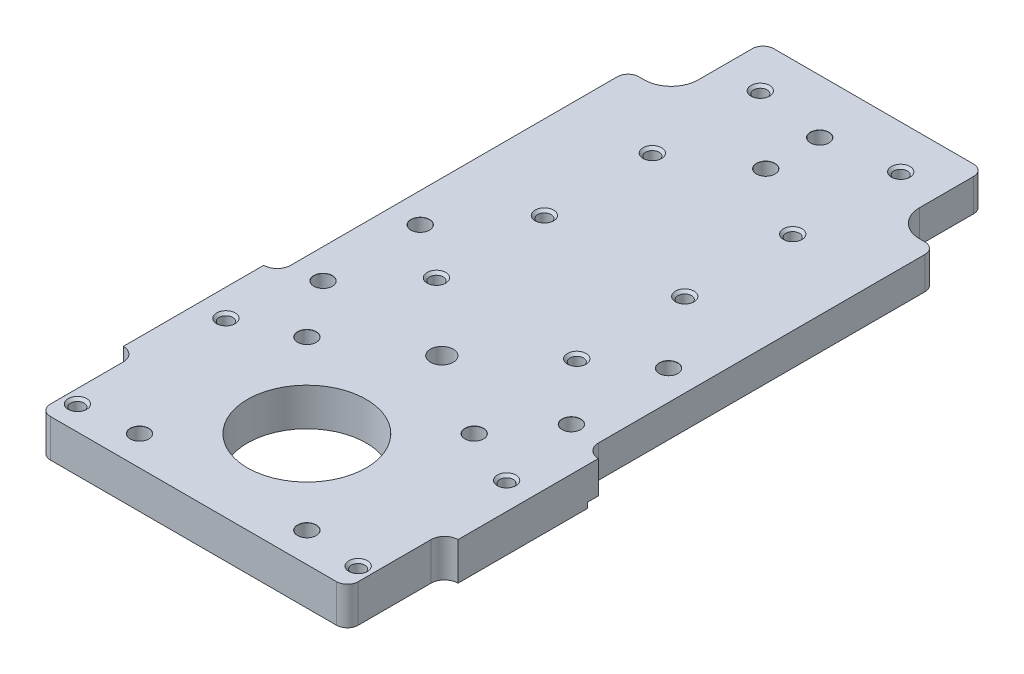
from build123d import *

# Parameters (mm, degrees)
PLATE_MAIN_SKETCH_R             = 11
PLATE_MAIN_SKETCH_R_2           = 2.111650326
EXTRUDE_PLATE_MAIN_DEPTH        = 7
FILLET1_R                       = 2
M3X0_5_TAPPED_HOLE3_AT_2_COUNT  = 2
M3X0_5_TAPPED_HOLE3_AT_2_PITCH  = 27.5
M3X0_5_TAPPED_HOLE3_AT_3_COUNT  = 2
M3X0_5_TAPPED_HOLE3_AT_3_PITCH  = 58.823889705
M3X0_5_TAPPED_HOLE3_AT_4_COUNT  = 2
M3X0_5_TAPPED_HOLE3_AT_4_PITCH  = 66.206117542
M3X0_5_TAPPED_HOLE3_AT_5_COUNT  = 2
M3X0_5_TAPPED_HOLE3_AT_5_PITCH  = 83.20606949
M3X0_5_TAPPED_HOLE3_AT_6_COUNT  = 2
M3X0_5_TAPPED_HOLE3_AT_6_PITCH  = 101.307699609
M3X0_5_TAPPED_HOLE3_AT_7_COUNT  = 2
M3X0_5_TAPPED_HOLE3_AT_7_PITCH  = 120.013540903
M3X0_5_TAPPED_HOLE3_AT_8_COUNT  = 2
M3X0_5_TAPPED_HOLE3_AT_8_PITCH  = 114.242067558
M3X0_5_TAPPED_HOLE3_AT_9_COUNT  = 2
M3X0_5_TAPPED_HOLE3_AT_9_PITCH  = 94.399417371
M3X0_5_TAPPED_HOLE3_AT_10_COUNT = 2
M3X0_5_TAPPED_HOLE3_AT_10_PITCH = 74.640806534
M3X0_5_TAPPED_HOLE3_AT_11_COUNT = 2
M3X0_5_TAPPED_HOLE3_AT_11_PITCH = 55.056788864
M3X0_5_TAPPED_HOLE3_AT_12_COUNT = 2
M3X0_5_TAPPED_HOLE3_AT_12_PITCH = 52
CBORE_FOR_M3_SHCS1_AT_2_COUNT   = 2
CBORE_FOR_M3_SHCS1_AT_2_PITCH   = 31
CBORE_FOR_M3_SHCS1_AT_3_COUNT   = 2
CBORE_FOR_M3_SHCS1_AT_3_PITCH   = 43.840620434
CBORE_FOR_M3_SHCS1_AT_4_COUNT   = 2
CBORE_FOR_M3_SHCS1_AT_4_PITCH   = 31
CBORE_FOR_M3_SHCS1_AT_5_COUNT   = 2
CBORE_FOR_M3_SHCS1_AT_5_PITCH   = 42.172265768
CBORE_FOR_M3_SHCS1_AT_6_COUNT   = 2
CBORE_FOR_M3_SHCS1_AT_6_PITCH   = 56.608303278
CBORE_FOR_M3_SHCS1_AT_7_COUNT   = 2
CBORE_FOR_M3_SHCS1_AT_7_PITCH   = 70.86959856
CBORE_FOR_M3_SHCS1_AT_8_COUNT   = 2
CBORE_FOR_M3_SHCS1_AT_8_PITCH   = 59.970826241
CBORE_FOR_M3_SHCS1_AT_9_COUNT   = 2
CBORE_FOR_M3_SHCS1_AT_9_PITCH   = 101.688249075
CBORE_FOR_M3_SHCS1_AT_10_COUNT  = 2
CBORE_FOR_M3_SHCS1_AT_10_PITCH  = 111.581808553
CUT_RECESS_DEPTH                = 1


with BuildPart() as part:
    # Plate Main Sketch → Extrude Plate Main (new body)
    with BuildSketch(Plane(origin=(-158.085545862, 0, 24.679095537), x_dir=(-1, 0, 0), z_dir=(0, 1, 0))):
        with BuildLine():
            Line((-178.585545862, -24.679095537), (-137.585545862, -24.679095537))
            Line((-137.585545862, -24.679095537), (-137.585545862, -12.679095537))
            ThreePointArc((-137.585545862, -12.679095537), (-136.121079768, -9.143561631), (-132.585545862, -7.679095537))
            Line((-132.585545862, -7.679095537), (-129.585545862, -7.679095537))
            Line((-129.585545862, -7.679095537), (-129.585545862, 54.820904463))
            ThreePointArc((-129.585545862, 54.820904463), (-128.853312815, 56.588671416), (-127.085545862, 57.320904463))
            Line((-127.085545862, 57.320904463), (-127.085545862, 83.320904463))
            ThreePointArc((-127.085545862, 83.320904463), (-128.853312815, 84.05313751), (-129.585545862, 85.820904463))
            Line((-129.585545862, 85.820904463), (-129.585545862, 101.320904463))
            Line((-129.585545862, 101.320904463), (-186.585545862, 101.320904463))
            Line((-186.585545862, 101.320904463), (-186.585545862, 85.820904463))
            ThreePointArc((-186.585545862, 85.820904463), (-187.317778909, 84.05313751), (-189.085545862, 83.320904463))
            Line((-189.085545862, 83.320904463), (-189.085545862, 57.320904463))
            ThreePointArc((-189.085545862, 57.320904463), (-187.317778909, 56.588671416), (-186.585545862, 54.820904463))
            Line((-186.585545862, 54.820904463), (-186.585545862, -7.679095537))
            Line((-186.585545862, -7.679095537), (-183.585545862, -7.679095537))
            ThreePointArc((-183.585545862, -7.679095537), (-180.050011956, -9.143561631), (-178.585545862, -12.679095537))
            Line((-178.585545862, -12.679095537), (-178.585545862, -24.679095537))
        make_face()
        with Locations((-158.085545862, 80.320904463)):
            Circle(PLATE_MAIN_SKETCH_R, mode=Mode.SUBTRACT)
        with Locations((-158.085545862, 55.320904463)):
            Circle(PLATE_MAIN_SKETCH_R_2, mode=Mode.SUBTRACT)
    extrude(amount=EXTRUDE_PLATE_MAIN_DEPTH)

    # Fillet1
    fillet1_edges = [part.edges().sort_by_distance(p)[0] for p in [
        (-28.5, 3.5, 126),
        (-28.5, 3.5, 17),
        (-20.5, 3.5, 0),
        (20.5, 3.5, 0),
        (28.5, 3.5, 17),
        (28.5, 3.5, 126),
    ]]
    fillet(fillet1_edges, radius=FILLET1_R)

    # Sketch13 → M3x0.5 Tapped Hole3 (revolve, cut)
    with BuildSketch(Plane(origin=(26, 0, 121.5), x_dir=(0, 0, -1), z_dir=(1, 0, 0))):
        Polygon((0, 0), (0, 7), (1.725, 7), (1.25, 6.525), (1.25, 0), align=None)
    m3x0_5_tapped_hole3 = revolve(axis=Axis((26, -6.35, 121.5), (0, 1, 0)), mode=Mode.SUBTRACT)

    # M3x0.5 Tapped Hole3 at 2: M3x0.5 Tapped Hole3 ×2
    with Locations(*[(0, 0, -i * M3X0_5_TAPPED_HOLE3_AT_2_PITCH) for i in range(1, M3X0_5_TAPPED_HOLE3_AT_2_COUNT)]):
        add(m3x0_5_tapped_hole3, mode=Mode.SUBTRACT)

    # M3x0.5 Tapped Hole3 at 3: M3x0.5 Tapped Hole3 ×2
    with Locations(*[Vector(-0.8839945855497452, 0, -0.46749713658880765) * (i * M3X0_5_TAPPED_HOLE3_AT_3_PITCH) for i in range(1, M3X0_5_TAPPED_HOLE3_AT_3_COUNT)]):
        add(m3x0_5_tapped_hole3, mode=Mode.SUBTRACT)

    # M3x0.5 Tapped Hole3 at 4: M3x0.5 Tapped Hole3 ×2
    with Locations(*[Vector(-0.5890694311623529, 0, -0.8080824247996377) * (i * M3X0_5_TAPPED_HOLE3_AT_4_PITCH) for i in range(1, M3X0_5_TAPPED_HOLE3_AT_4_COUNT)]):
        add(m3x0_5_tapped_hole3, mode=Mode.SUBTRACT)

    # M3x0.5 Tapped Hole3 at 5: M3x0.5 Tapped Hole3 ×2
    with Locations(*[Vector(-0.46871580689935055, 0, -0.8833490206949294) * (i * M3X0_5_TAPPED_HOLE3_AT_5_PITCH) for i in range(1, M3X0_5_TAPPED_HOLE3_AT_5_COUNT)]):
        add(m3x0_5_tapped_hole3, mode=Mode.SUBTRACT)

    # M3x0.5 Tapped Hole3 at 6: M3x0.5 Tapped Hole3 ×2
    with Locations(*[Vector(-0.38496580369162126, 0, -0.9229308370555532) * (i * M3X0_5_TAPPED_HOLE3_AT_6_PITCH) for i in range(1, M3X0_5_TAPPED_HOLE3_AT_6_COUNT)]):
        add(m3x0_5_tapped_hole3, mode=Mode.SUBTRACT)

    # M3x0.5 Tapped Hole3 at 7: M3x0.5 Tapped Hole3 ×2
    with Locations(*[Vector(-0.32496333085967716, 0, -0.9457266167326497) * (i * M3X0_5_TAPPED_HOLE3_AT_7_PITCH) for i in range(1, M3X0_5_TAPPED_HOLE3_AT_7_COUNT)]):
        add(m3x0_5_tapped_hole3, mode=Mode.SUBTRACT)

    # M3x0.5 Tapped Hole3 at 8: M3x0.5 Tapped Hole3 ×2
    with Locations(*[Vector(-0.113793458730633, 0, -0.993504428148219) * (i * M3X0_5_TAPPED_HOLE3_AT_8_PITCH) for i in range(1, M3X0_5_TAPPED_HOLE3_AT_8_COUNT)]):
        add(m3x0_5_tapped_hole3, mode=Mode.SUBTRACT)

    # M3x0.5 Tapped Hole3 at 9: M3x0.5 Tapped Hole3 ×2
    with Locations(*[Vector(-0.13771271435815216, 0, -0.9904722148067102) * (i * M3X0_5_TAPPED_HOLE3_AT_9_PITCH) for i in range(1, M3X0_5_TAPPED_HOLE3_AT_9_COUNT)]):
        add(m3x0_5_tapped_hole3, mode=Mode.SUBTRACT)

    # M3x0.5 Tapped Hole3 at 10: M3x0.5 Tapped Hole3 ×2
    with Locations(*[Vector(-0.17416746420246676, 0, -0.9847160476062541) * (i * M3X0_5_TAPPED_HOLE3_AT_10_PITCH) for i in range(1, M3X0_5_TAPPED_HOLE3_AT_10_COUNT)]):
        add(m3x0_5_tapped_hole3, mode=Mode.SUBTRACT)

    # M3x0.5 Tapped Hole3 at 11: M3x0.5 Tapped Hole3 ×2
    with Locations(*[Vector(-0.23611983677697992, 0, -0.9717239436591096) * (i * M3X0_5_TAPPED_HOLE3_AT_11_PITCH) for i in range(1, M3X0_5_TAPPED_HOLE3_AT_11_COUNT)]):
        add(m3x0_5_tapped_hole3, mode=Mode.SUBTRACT)

    # M3x0.5 Tapped Hole3 at 12: M3x0.5 Tapped Hole3 ×2
    with Locations(*[(-i * M3X0_5_TAPPED_HOLE3_AT_12_PITCH, 0, 0) for i in range(1, M3X0_5_TAPPED_HOLE3_AT_12_COUNT)]):
        add(m3x0_5_tapped_hole3, mode=Mode.SUBTRACT)

    # Sketch5 → CBORE for M3 SHCS1 (revolve, cut)
    with BuildSketch(Plane(origin=(-15.5, 0, 120.5), x_dir=(0, 0, -1), z_dir=(1, 0, 0))):
        Polygon((0, 0), (0, 7), (1.725, 7), (1.7, 6.975), (1.7, 4.5), (3, 4.5), (3, 0), align=None)
    cbore_for_m3_shcs1 = revolve(axis=Axis((-15.5, -6.35, 120.5), (0, 1, 0)), mode=Mode.SUBTRACT)

    # CBORE for M3 SHCS1 at 2: CBORE for M3 SHCS1 ×2
    with Locations(*[(i * CBORE_FOR_M3_SHCS1_AT_2_PITCH, 0, 0) for i in range(1, CBORE_FOR_M3_SHCS1_AT_2_COUNT)]):
        add(cbore_for_m3_shcs1, mode=Mode.SUBTRACT)

    # CBORE for M3 SHCS1 at 3: CBORE for M3 SHCS1 ×2
    with Locations(*[Vector(0.7071067811865479, 0, -0.7071067811865472) * (i * CBORE_FOR_M3_SHCS1_AT_3_PITCH) for i in range(1, CBORE_FOR_M3_SHCS1_AT_3_COUNT)]):
        add(cbore_for_m3_shcs1, mode=Mode.SUBTRACT)

    # CBORE for M3 SHCS1 at 4: CBORE for M3 SHCS1 ×2
    with Locations(*[(0, 0, -i * CBORE_FOR_M3_SHCS1_AT_4_PITCH) for i in range(1, CBORE_FOR_M3_SHCS1_AT_4_COUNT)]):
        add(cbore_for_m3_shcs1, mode=Mode.SUBTRACT)

    # CBORE for M3 SHCS1 at 5: CBORE for M3 SHCS1 ×2
    with Locations(*[Vector(-0.1778419978967634, 0, -0.9840590550287557) * (i * CBORE_FOR_M3_SHCS1_AT_5_PITCH) for i in range(1, CBORE_FOR_M3_SHCS1_AT_5_COUNT)]):
        add(cbore_for_m3_shcs1, mode=Mode.SUBTRACT)

    # CBORE for M3 SHCS1 at 6: CBORE for M3 SHCS1 ×2
    with Locations(*[Vector(0.6801122409730789, 0, -0.7331080000099417) * (i * CBORE_FOR_M3_SHCS1_AT_6_PITCH) for i in range(1, CBORE_FOR_M3_SHCS1_AT_6_COUNT)]):
        add(cbore_for_m3_shcs1, mode=Mode.SUBTRACT)

    # CBORE for M3 SHCS1 at 7: CBORE for M3 SHCS1 ×2
    with Locations(*[Vector(0.5432512781572745, 0, -0.8395701571521512) * (i * CBORE_FOR_M3_SHCS1_AT_7_PITCH) for i in range(1, CBORE_FOR_M3_SHCS1_AT_7_COUNT)]):
        add(cbore_for_m3_shcs1, mode=Mode.SUBTRACT)

    # CBORE for M3 SHCS1 at 8: CBORE for M3 SHCS1 ×2
    with Locations(*[Vector(-0.12506080823181873, 0, -0.9921490786390946) * (i * CBORE_FOR_M3_SHCS1_AT_8_PITCH) for i in range(1, CBORE_FOR_M3_SHCS1_AT_8_COUNT)]):
        add(cbore_for_m3_shcs1, mode=Mode.SUBTRACT)

    # CBORE for M3 SHCS1 at 9: CBORE for M3 SHCS1 ×2
    with Locations(*[Vector(0.15242665834989907, 0, -0.9883147847848291) * (i * CBORE_FOR_M3_SHCS1_AT_9_PITCH) for i in range(1, CBORE_FOR_M3_SHCS1_AT_9_COUNT)]):
        add(cbore_for_m3_shcs1, mode=Mode.SUBTRACT)

    # CBORE for M3 SHCS1 at 10: CBORE for M3 SHCS1 ×2
    with Locations(*[Vector(0.13891153227375555, 0, -0.9903047945967733) * (i * CBORE_FOR_M3_SHCS1_AT_10_PITCH) for i in range(1, CBORE_FOR_M3_SHCS1_AT_10_COUNT)]):
        add(cbore_for_m3_shcs1, mode=Mode.SUBTRACT)

    # Reccess Sketch → Cut Recess (cut)
    with BuildSketch(Plane(origin=(0, 0, 0), x_dir=(1, 0, 0), z_dir=(0, 1, 0))):
        with BuildLine():
            Line((-8.25, 0), (-8.25, -81))
            ThreePointArc((-8.25, -81), (-9.128679656, -83.121320344), (-11.25, -84))
            Line((-11.25, -84), (-31, -84))
            Line((-31, -84), (-31, 0))
            Line((-31, 0), (-8.25, 0))
        make_face()
        with BuildLine():
            Line((31, 0), (8.25, 0))
            Line((8.25, 0), (8.25, -81))
            ThreePointArc((8.25, -81), (9.128679656, -83.121320344), (11.25, -84))
            Line((11.25, -84), (31, -84))
            Line((31, -84), (31, 0))
        make_face()
    extrude(amount=CUT_RECESS_DEPTH, mode=Mode.SUBTRACT)


solid = part.part
